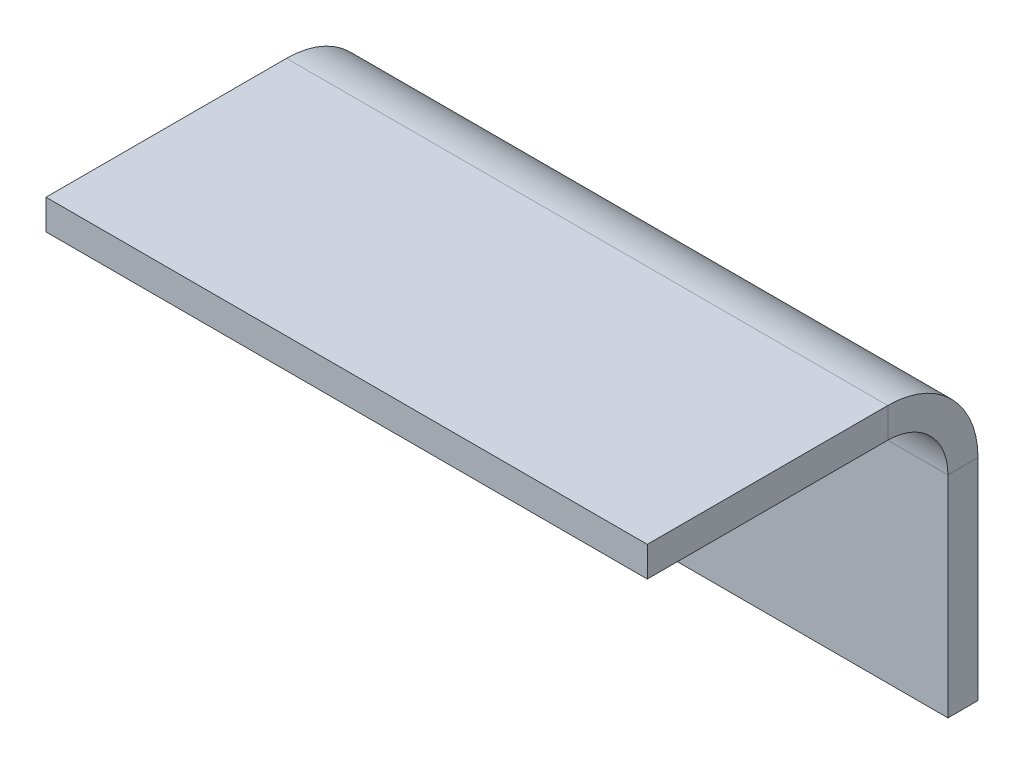
from build123d import *

# Parameters (mm, degrees)
SKETCH_1_W                 = 20
SKETCH_1_H                 = 10
BASEPLATE_DEPTH            = 1
EDGEFLANGE_STRIP_W         = 8
EDGEFLANGE_STRIP_H         = 1
EDGEFLANGE_STRIP_CUT_DEPTH = 20
EDGEFLANGE_DEPTH           = 20
EDGEFLANGE_FLAT_DEPTH      = 1


# Sheet-metal steps are written as plain solids
with BuildPart() as part:
    # Sketch 1 → BasePlate (new body)
    with BuildSketch(Plane.XY):
        with Locations((10, 5)):
            Rectangle(SKETCH_1_W, SKETCH_1_H)
    extrude(amount=-BASEPLATE_DEPTH)

    # EdgeFlange strip (across the edge) → EdgeFlange strip cut (cut)
    with BuildSketch(Plane(origin=(20, 10, 0), x_dir=(0, -1, 0), z_dir=(-1, 0, 0))):
        with Locations((-1, -0.5)):
            Rectangle(EDGEFLANGE_STRIP_W, EDGEFLANGE_STRIP_H)
    extrude(amount=EDGEFLANGE_STRIP_CUT_DEPTH, mode=Mode.SUBTRACT)

    # EdgeFlange bend section (across the edge) → EdgeFlange (add)
    with BuildSketch(Plane(origin=(20, 10, 0), x_dir=(0, -1, 0), z_dir=(-1, 0, 0))):
        with BuildLine():
            Line((0, 2), (1, 2))
            ThreePointArc((1, 2), (1.585786438, 0.585786438), (3, 0))
            Line((3, 0), (3, -1))
            ThreePointArc((3, -1), (0.878679656, -0.121320344), (0, 2))
        make_face()
    extrude(amount=EDGEFLANGE_DEPTH)

    # EdgeFlange profile (on flange) → EdgeFlange flat (add)
    with BuildSketch(Plane(origin=(0, 10, 0), x_dir=(-1, 0, 0), z_dir=(0, 1, 0))):
        Polygon((-20, 10), (-20, 2), (0, 2), (0, 10), (-2, 10), (-18, 10), align=None)
    extrude(amount=-EDGEFLANGE_FLAT_DEPTH)


solid = part.part
